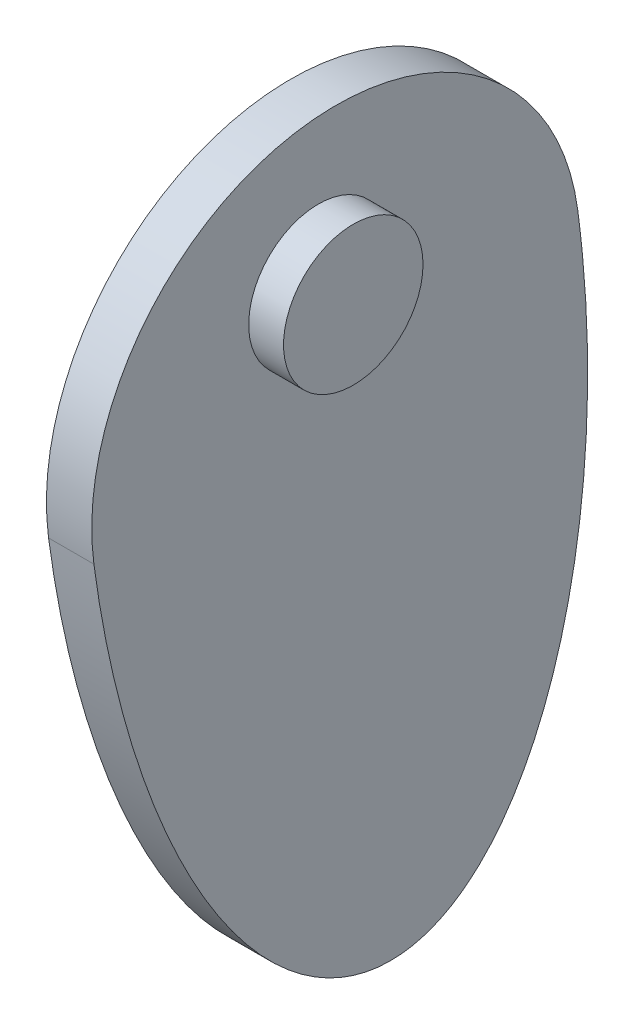
from build123d import *

# Parameters (mm, degrees)
RESSALTO_EXTRUS_O11_DEPTH = 13
ESBO_O44_R                = 20
RESSALTO_EXTRUS_O12_DEPTH = 10


with BuildPart() as part:
    # Esboço43 → Ressalto-extrusão11 (new body)
    with BuildSketch(Plane(origin=(0, 0, 0), x_dir=(0, 0, -1), z_dir=(1, 0, 0))):
        with BuildLine():
            ThreePointArc((69.385953048, 9.251460406), (-9.251460406, 69.385953048), (-69.385953048, -9.251460406))
            add(Edge.make_bspline(
                [(-69.385953048, -9.251460406), (-49.385953048, -159.251460406), (20, -150), (89.385953048, -140.748539594), (69.385953048, 9.251460406)],
                knots=[4.71238898, 4.71238898, 4.71238898, 6.283185307, 6.283185307, 7.853981634, 7.853981634, 7.853981634], degree=2, weights=[1, 0.707106781, 1, 0.707106781, 1]))
        make_face()
    extrude(amount=RESSALTO_EXTRUS_O11_DEPTH)

    # Esboço44 → Ressalto-extrusão12 (add)
    with BuildSketch(Plane(origin=(0, 0, 0), x_dir=(0, 0, -1), z_dir=(1, 0, 0))):
        with Locations((-5, 28.000002978)):
            Circle(ESBO_O44_R)
    extrude(amount=-RESSALTO_EXTRUS_O12_DEPTH)


with BuildPart() as body_2:
    # Espelhar3: mirrored copy
    add(part.part.mirror(Plane(origin=(-50, 0, 0), x_dir=(0, 0, 1), z_dir=(1, 0, 0))))


solid = body_2.part
